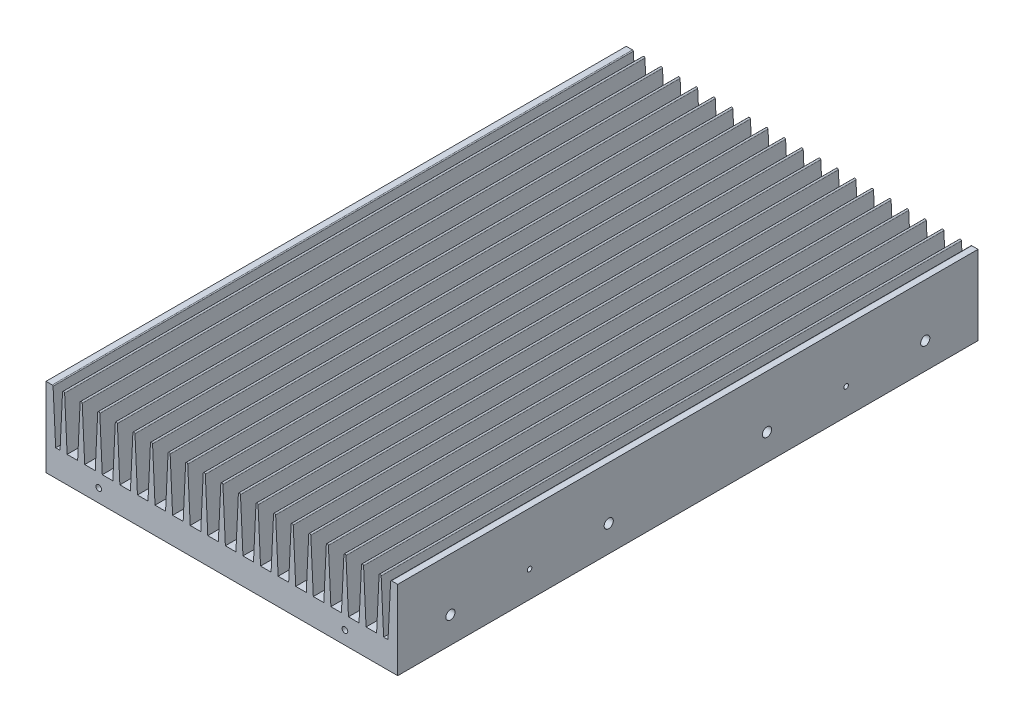
from build123d import *

# Parameters (mm, degrees)
EXTRUDE_1_DEPTH       = 330
EXTRUDE_3_DEPTH       = 330
PATTERN_CURVE_1_COUNT = 19
PATTERN_CURVE_1_PITCH = 10
SKETCH_3_R            = 2.1
SKETCH_3_R_2          = 2.6
SKETCH_3_R_3          = 1.3
CUT_EXTRUDE_1_DEPTH   = 8
SKETCH_4_R            = 2.6
SKETCH_4_R_2          = 1.3
CUT_EXTRUDE_2_DEPTH   = 8
CUT_EXTRUDE_START     = -10
SKETCH_6_R            = 2.6
SKETCH_6_R_2          = 1.3
CUT_EXTRUDE_5_DEPTH   = 10
SKETCH_7_R            = 1.6
CUT_EXTRUDE_6_DEPTH   = 8
CUT_EXTRUDE_START_2   = -8
SKETCH_8_R            = 1.6
CUT_EXTRUDE_7_DEPTH   = 8
SKETCH_9_R            = 1.6
CUT_EXTRUDE_8_DEPTH   = 8
SKETCH_10_R           = 1.6
CUT_EXTRUDE_9_DEPTH   = 10


with BuildPart() as part:
    # Эскиз1 → Вытянуть1 (new body)
    with BuildSketch(Plane.XY):
        with BuildLine():
            Line((0, 45), (3.52437539, 45))
            ThreePointArc((3.52437539, 45), (3.868987923, 44.862273656), (4.02375156, 44.524968808))
            Line((4.02375156, 44.524968808), (5.5, 15))
            Line((5.5, 15), (194.5, 15))
            Line((194.5, 15), (195.97624844, 44.524968808))
            ThreePointArc((195.97624844, 44.524968808), (196.131012077, 44.862273656), (196.47562461, 45))
            Line((196.47562461, 45), (200, 45))
            Line((200, 45), (200, 0))
            Line((200, 0), (0, 0))
            Line((0, 0), (0, 45))
        make_face()
    extrude(amount=EXTRUDE_1_DEPTH)

    # Эскиз2 → Вытянуть3 (add)
    with BuildSketch(Plane.XY.offset(330)):
        with BuildLine():
            Line((9.40067846, 44.428525275), (8, 15))
            Line((8, 15), (12, 15))
            Line((12, 15), (10.59932154, 44.428525275))
            ThreePointArc((10.59932154, 44.428525275), (10, 45), (9.40067846, 44.428525275))
        make_face()
    extrude_3 = extrude(amount=-EXTRUDE_3_DEPTH)

    # Кривая1: Вытянуть3 ×19
    with Locations(*[(i * PATTERN_CURVE_1_PITCH, 0, 0) for i in range(1, PATTERN_CURVE_1_COUNT)]):
        add(extrude_3)

    # Эскиз3 → Вырез-Вытянуть1 (cut)
    with BuildSketch(Plane.XZ):
        with Locations((9.5, 19.5)):
            Circle(SKETCH_3_R)
        with Locations((188.5, 40)):
            Circle(SKETCH_3_R)
        with Locations((163.5, 130)):
            Circle(SKETCH_3_R)
        with Locations((11.5, 151)):
            Circle(SKETCH_3_R)
        with Locations((63.5, 189)):
            Circle(SKETCH_3_R)
        with Locations((16.5, 240)):
            Circle(SKETCH_3_R)
        with Locations((39.5, 79.5)):
            Circle(SKETCH_3_R_2)
        with Locations((114.5, 30)):
            Circle(SKETCH_3_R)
        with Locations((181.5, 210)):
            Circle(SKETCH_3_R)
        with Locations((16.58, 183.75)):
            Circle(SKETCH_3_R_2)
        with Locations((84, 49)):
            Circle(SKETCH_3_R_3)
        with Locations((89, 89)):
            Circle(SKETCH_3_R_3)
        with Locations((61.5, 170)):
            Circle(SKETCH_3_R_3)
        with Locations((61.5, 210)):
            Circle(SKETCH_3_R_3)
        with Locations((108.5, 190)):
            Circle(SKETCH_3_R_3)
        with Locations((138, 189.5)):
            Circle(SKETCH_3_R)
    extrude(amount=-CUT_EXTRUDE_1_DEPTH, mode=Mode.SUBTRACT)

    # Эскиз4 → Вырез-Вытянуть2 (cut)
    with BuildSketch(Plane.ZY):
        with Locations((30, 15)):
            Circle(SKETCH_4_R)
        with Locations((75, 15)):
            Circle(SKETCH_4_R_2)
        with Locations((120, 15)):
            Circle(SKETCH_4_R)
        with Locations((210, 15)):
            Circle(SKETCH_4_R)
        with Locations((255, 15)):
            Circle(SKETCH_4_R_2)
        with Locations((300, 15)):
            Circle(SKETCH_4_R)
    extrude(amount=-CUT_EXTRUDE_2_DEPTH, mode=Mode.SUBTRACT)

    # Эскиз6 → Вырез-Вытянуть5 (cut)
    with BuildSketch(Plane(origin=(200, 0, 0), x_dir=(0, 0, -1), z_dir=(1, 0, 0)).offset(CUT_EXTRUDE_START)):
        with Locations((-30, 15)):
            Circle(SKETCH_6_R)
        with Locations((-75, 15)):
            Circle(SKETCH_6_R_2)
        with Locations((-120, 15)):
            Circle(SKETCH_6_R)
        with Locations((-210, 15)):
            Circle(SKETCH_6_R)
        with Locations((-255, 15)):
            Circle(SKETCH_6_R_2)
        with Locations((-300, 15)):
            Circle(SKETCH_6_R)
    extrude(amount=CUT_EXTRUDE_5_DEPTH, mode=Mode.SUBTRACT)

    # Эскиз7 → Вырез-Вытянуть6 (cut)
    with BuildSketch(Plane.XY.offset(330)):
        with Locations((30, 7.5)):
            Circle(SKETCH_7_R)
        with Locations((170, 7.5)):
            Circle(SKETCH_7_R)
    extrude(amount=-CUT_EXTRUDE_6_DEPTH, mode=Mode.SUBTRACT)

    # Эскиз8 → Вырез-Вытянуть7 (cut)
    with BuildSketch(Plane(origin=(0, 0, 0), x_dir=(-1, 0, 0), z_dir=(0, 0, -1)).offset(CUT_EXTRUDE_START_2)):
        with Locations((-30, 7.5)):
            Circle(SKETCH_8_R)
        with Locations((-170, 7.5)):
            Circle(SKETCH_8_R)
    extrude(amount=CUT_EXTRUDE_7_DEPTH, mode=Mode.SUBTRACT)

    # Эскиз9 → Вырез-Вытянуть8 (cut)
    with BuildSketch(Plane.XZ):
        with Locations((147, 320)):
            Circle(SKETCH_9_R)
        with Locations((147, 265)):
            Circle(SKETCH_9_R)
    extrude(amount=-CUT_EXTRUDE_8_DEPTH, mode=Mode.SUBTRACT)

    # Эскиз10 → Вырез-Вытянуть9 (cut)
    with BuildSketch(Plane.XZ):
        with Locations((111.453923093, 292.5)):
            Circle(SKETCH_10_R)
        with Locations((182.546076907, 292.5)):
            Circle(SKETCH_10_R)
    extrude(amount=-CUT_EXTRUDE_9_DEPTH, mode=Mode.SUBTRACT)


solid = part.part
